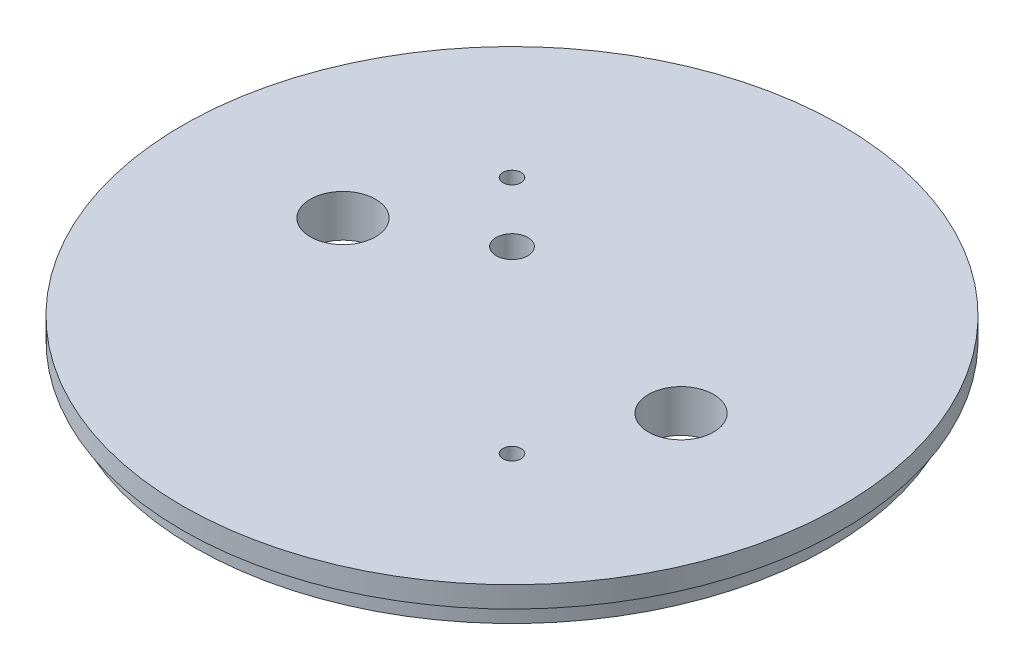
from build123d import *

# Parameters (mm, degrees)
SKETCH1_R           = 49.5173
SKETCH1_R_2         = 4.9022
SKETCH1_R_3         = 1.3589
SKETCH1_R_4         = 2.38125
BOSS_EXTRUDE1_DEPTH = 6.35
SKETCH2_R           = 49.5173
SKETCH2_R_2         = 47.6885
CUT_EXTRUDE1_DEPTH  = 3.175
CUT_EXTRUDE2_START  = -2.794
CUT_EXTRUDE2_DEPTH  = 3.81


with BuildPart() as part:
    # Sketch1 → Boss-Extrude1 (new body)
    with BuildSketch(Plane(origin=(0, 0, 0), x_dir=(1, 0, 0), z_dir=(0, 1, 0))):
        Circle(SKETCH1_R)
        with Locations((25.4, 0)):
            Circle(SKETCH1_R_2, mode=Mode.SUBTRACT)
        with Locations((-25.4, 0)):
            Circle(SKETCH1_R_2, mode=Mode.SUBTRACT)
        with Locations((-17.960512242, 17.960512242)):
            Circle(SKETCH1_R_3, mode=Mode.SUBTRACT)
        with Locations((17.960512242, -17.960512242)):
            Circle(SKETCH1_R_3, mode=Mode.SUBTRACT)
        with Locations((-8.980256121, 8.980256121)):
            Circle(SKETCH1_R_4, mode=Mode.SUBTRACT)
    extrude(amount=BOSS_EXTRUDE1_DEPTH)

    # Sketch2 → Cut-Extrude1 (cut)
    with BuildSketch(Plane.XZ):
        Circle(SKETCH2_R)
        Circle(SKETCH2_R_2, mode=Mode.SUBTRACT)
    extrude(amount=-CUT_EXTRUDE1_DEPTH, mode=Mode.SUBTRACT)

    # Sketch3 → Cut-Extrude2 (cut)
    with BuildSketch(Plane(origin=(0, 6.35, 0), x_dir=(1, 0, 0), z_dir=(0, 1, 0)).offset(CUT_EXTRUDE2_START)):
        with BuildLine():
            Line((3.2385, 34.925), (3.2385, 13.335))
            ThreePointArc((3.2385, 13.335), (0, 10.0965), (-3.2385, 13.335))
            Line((-3.2385, 13.335), (-3.2385, 34.925))
            ThreePointArc((-3.2385, 34.925), (0, 38.1635), (3.2385, 34.925))
        make_face()
        with BuildLine():
            Line((3.2385, -34.925), (3.2385, -13.335))
            ThreePointArc((3.2385, -13.335), (0, -10.0965), (-3.2385, -13.335))
            Line((-3.2385, -13.335), (-3.2385, -34.925))
            ThreePointArc((-3.2385, -34.925), (0, -38.1635), (3.2385, -34.925))
        make_face()
    extrude(amount=-CUT_EXTRUDE2_DEPTH, mode=Mode.SUBTRACT)


solid = part.part
